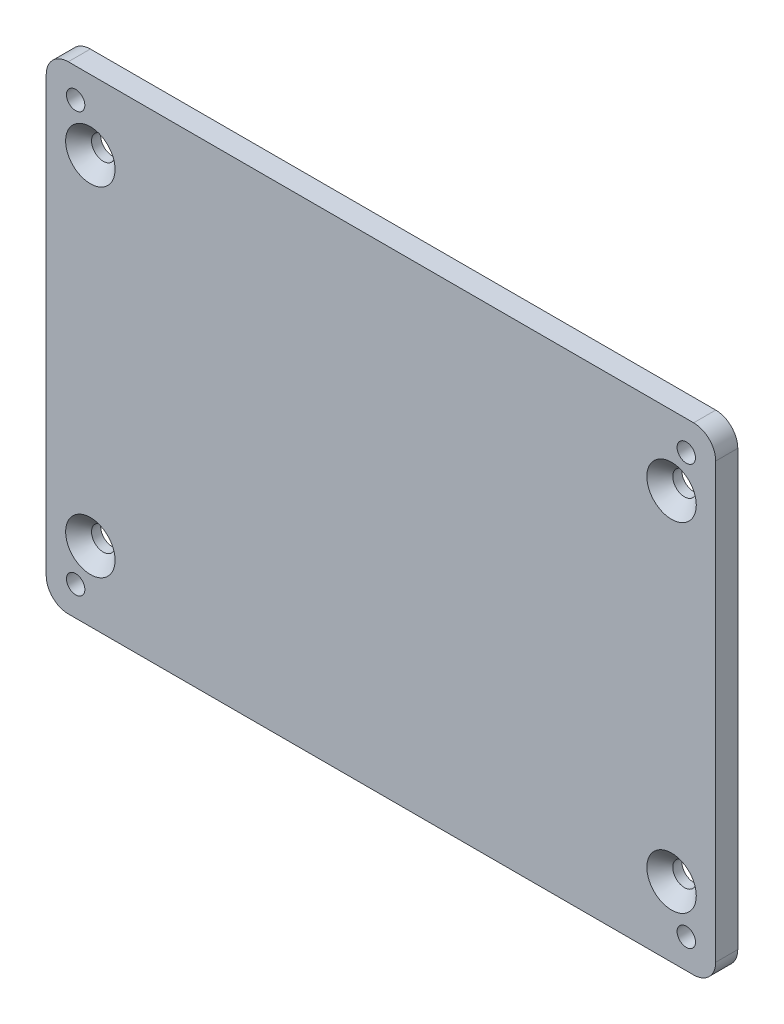
from build123d import *

# Parameters (mm, degrees)
SKETCH1_W                    = 91
SKETCH1_H                    = 65
BOSS_EXTRUDE1_DEPTH          = 3
TAP_DRILL_FOR_M3X0_5_TAP1_D  = 2.5
FILLET1_R                    = 3
CSK_FOR_M3_SFHCS1_AT_2_COUNT = 2
CSK_FOR_M3_SFHCS1_AT_2_PITCH = 46
CSK_FOR_M3_SFHCS1_AT_3_COUNT = 2
CSK_FOR_M3_SFHCS1_AT_3_PITCH = 91.416628684
CSK_FOR_M3_SFHCS1_AT_4_COUNT = 2
CSK_FOR_M3_SFHCS1_AT_4_PITCH = 79


with BuildPart() as part:
    # Sketch1 → Boss-Extrude1 (new body)
    with BuildSketch(Plane.XY):
        Rectangle(SKETCH1_W, SKETCH1_H)
    extrude(amount=BOSS_EXTRUDE1_DEPTH)

    # Tap Drill for M3x0.5 Tap1 (through all)
    with Locations(Plane.XY.offset(3)):
        with Locations((-41.5, 28.5), (41.5, 28.5), (41.5, -28.5), (-41.5, -28.5)):
            Hole(TAP_DRILL_FOR_M3X0_5_TAP1_D / 2)

    # Fillet1
    fillet1_edges = [part.edges().sort_by_distance(p)[0] for p in [
        (45.5, 32.5, 1.5),
        (45.5, -32.5, 1.5),
        (-45.5, -32.5, 1.5),
        (-45.5, 32.5, 1.5),
    ]]
    fillet(fillet1_edges, radius=FILLET1_R)

    # Sketch7 → CSK for M3 SFHCS1 (revolve, cut)
    with BuildSketch(Plane(origin=(-39.5, 23, 3), x_dir=(0, -1, 0), z_dir=(1, 0, 0))):
        Polygon((0, 0), (0, 3), (1.6, 3), (1.6, 1.76), (3.36, 0), align=None)
    csk_for_m3_sfhcs1 = revolve(axis=Axis((-39.5, 23, 9.35), (0, 0, -1)), mode=Mode.SUBTRACT)

    # CSK for M3 SFHCS1 at 2: CSK for M3 SFHCS1 ×2
    with Locations(*[(0, -i * CSK_FOR_M3_SFHCS1_AT_2_PITCH, 0) for i in range(1, CSK_FOR_M3_SFHCS1_AT_2_COUNT)]):
        add(csk_for_m3_sfhcs1, mode=Mode.SUBTRACT)

    # CSK for M3 SFHCS1 at 3: CSK for M3 SFHCS1 ×2
    with Locations(*[Vector(0.8641753818425661, -0.5031907286678234, 0) * (i * CSK_FOR_M3_SFHCS1_AT_3_PITCH) for i in range(1, CSK_FOR_M3_SFHCS1_AT_3_COUNT)]):
        add(csk_for_m3_sfhcs1, mode=Mode.SUBTRACT)

    # CSK for M3 SFHCS1 at 4: CSK for M3 SFHCS1 ×2
    with Locations(*[(i * CSK_FOR_M3_SFHCS1_AT_4_PITCH, 0, 0) for i in range(1, CSK_FOR_M3_SFHCS1_AT_4_COUNT)]):
        add(csk_for_m3_sfhcs1, mode=Mode.SUBTRACT)


solid = part.part
